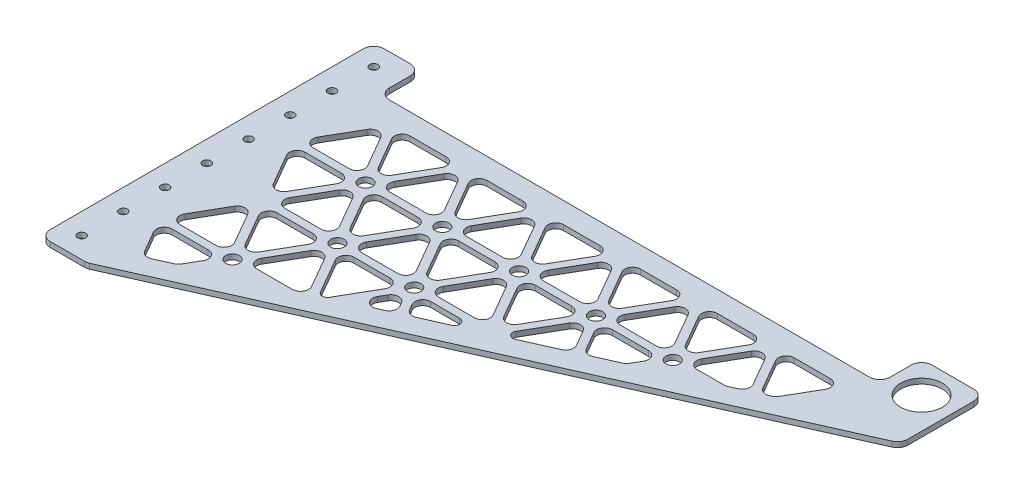
from build123d import *

# Parameters (mm, degrees)
BOSS_EXTRUDE1_DEPTH = 1.5875
SKETCH2_R           = 2.4892
SKETCH2_R_2         = 12.7
CUT_EXTRUDE1_DEPTH  = 424.43121785
FILLET1_R           = 6.35
SKETCH3_R           = 4.124445986
CUT_EXTRUDE2_DEPTH  = 424.43121785
FILLET2_R           = 4.7625


with BuildPart() as part:
    # Sketch1 → Boss-Extrude1 (new, symmetric)
    with BuildSketch(Plane(origin=(0, 0, 0), x_dir=(1, 0, 0), z_dir=(0, 1, 0))):
        Polygon((0, 0), (0, 203.2), (28.575, 203.2), (28.575, 177.8), (333.375, 177.8), (333.375, 203.2), (371.475, 203.2), (371.475, 152.668916192), (28.575, 0), align=None)
    extrude(amount=BOSS_EXTRUDE1_DEPTH, both=True)

    # Sketch2 → Cut-Extrude1 (cut, through all)
    with BuildSketch(Plane(origin=(0, 1.5875, 0), x_dir=(1, 0, 0), z_dir=(0, 1, 0))):
        with Locations(Location((12.7, 190.5, 0), (0, 0, 270))):
            Circle(SKETCH2_R)
        with Locations(Location((12.7, 165.1, 0), (0, 0, 270))):
            Circle(SKETCH2_R)
        with Locations(Location((12.7, 139.7, 0), (0, 0, 270))):
            Circle(SKETCH2_R)
        with Locations(Location((12.7, 114.3, 0), (0, 0, 270))):
            Circle(SKETCH2_R)
        with Locations(Location((12.7, 88.9, 0), (0, 0, 270))):
            Circle(SKETCH2_R)
        with Locations(Location((12.7, 63.5, 0), (0, 0, 270))):
            Circle(SKETCH2_R)
        with Locations(Location((12.7, 38.1, 0), (0, 0, 270))):
            Circle(SKETCH2_R)
        with Locations(Location((12.7, 12.7, 0), (0, 0, 270))):
            Circle(SKETCH2_R)
        with Locations(Location((352.425, 184.15, 0), (0, 0, 270))):
            Circle(SKETCH2_R_2)
    extrude(amount=-CUT_EXTRUDE1_DEPTH, mode=Mode.SUBTRACT)

    # Fillet1
    fillet1_edges = [part.edges().sort_by_distance(p)[0] for p in [
        (0, 0, 0),
        (0, 0, -203.2),
        (28.575, 0, -203.2),
        (28.575, 0, -177.8),
        (333.375, 0, -177.8),
        (333.375, 0, -203.2),
        (371.475, 0, -203.2),
        (371.475, 0, -152.668916192),
        (28.575, 0, 0),
    ]]
    fillet(fillet1_edges, radius=FILLET1_R)

    # Sketch3 → Cut-Extrude2 (cut, through all)
    with BuildSketch(Plane(origin=(0, 1.5875, 0), x_dir=(1, 0, 0), z_dir=(0, 1, 0))):
        with BuildLine():
            Line((120.68762701, 55.5625), (137.185410952, 84.1375))
            Line((137.185410952, 84.1375), (98.690581754, 84.1375))
            Line((98.690581754, 84.1375), (115.188365696, 55.5625))
            ThreePointArc((115.188365696, 55.5625), (117.937996353, 53.975), (120.68762701, 55.5625))
        make_face()
        Polygon((141.309856938, 81.75625), (127.58490085, 57.983928725), (149.421620805, 67.706262842), align=None)
        Polygon((106.101157685, 48.41875), (112.236454516, 51.150360142), (94.566135768, 81.75625), (75.318721169, 48.41875), align=None)
        with BuildLine():
            Line((145.434302923, 84.1375), (153.796346251, 69.654016101))
            Line((153.796346251, 69.654016101), (172.680971947, 78.061993172))
            ThreePointArc((172.680971947, 78.061993172), (174.495201737, 81.622619618), (171.389583105, 84.1375))
            Line((171.389583105, 84.1375), (145.434302923, 84.1375))
        make_face()
        with BuildLine():
            ThreePointArc((195.387344652, 94.458706266), (195.777490488, 90.746716591), (199.42836415, 89.970699438))
            Line((199.42836415, 89.970699438), (223.791953383, 100.818068242))
            Line((223.791953383, 100.818068242), (211.425438692, 122.2375))
            Line((211.425438692, 122.2375), (195.387344652, 94.458706266))
        make_face()
        Polygon((215.549884677, 124.61875), (228.166678829, 102.765821501), (246.016187789, 110.712934908), (254.044713875, 124.61875), align=None)
        Polygon((42.240847384, 19.986308002), (57.266324231, 26.676081304), (67.069829198, 43.65625), (28.575, 43.65625), align=None)
        Polygon((262.293605846, 129.38125), (287.945909992, 129.38125), (298.162285961, 133.929873641), (281.541020445, 162.71875), align=None)
        Polygon((285.665466431, 165.1), (302.537011407, 135.8776269), (308.932808975, 138.725219443), (324.160295629, 165.1), align=None)
        Polygon((90.441689783, 165.1), (51.946860585, 165.1), (71.194275184, 131.7625), align=None)
        Polygon((137.185410952, 165.1), (98.690581754, 165.1), (117.937996353, 131.7625), align=None)
        Polygon((258.169159861, 131.7625), (277.41657446, 165.1), (238.921745262, 165.1), align=None)
        Polygon((183.929132121, 165.1), (145.434302923, 165.1), (164.681717522, 131.7625), align=None)
        Polygon((211.425438692, 131.7625), (230.672853291, 165.1), (192.178024092, 165.1), align=None)
        Polygon((28.575, 129.38125), (67.069829198, 129.38125), (47.822414599, 162.71875), align=None)
        Polygon((94.566135768, 162.71875), (75.318721169, 129.38125), (113.813550367, 129.38125), align=None)
        Polygon((47.822414599, 91.28125), (67.069829198, 124.61875), (28.575, 124.61875), align=None)
        Polygon((90.441689783, 88.9), (71.194275184, 122.2375), (51.946860585, 88.9), align=None)
        Polygon((113.813550367, 124.61875), (75.318721169, 124.61875), (94.566135768, 91.28125), align=None)
        Polygon((160.557271537, 129.38125), (141.309856938, 162.71875), (122.062442339, 129.38125), align=None)
        Polygon((168.806163508, 129.38125), (207.300992706, 129.38125), (188.053578107, 162.71875), align=None)
        Polygon((234.797299276, 162.71875), (215.549884677, 129.38125), (254.044713875, 129.38125), align=None)
        Polygon((188.053578107, 91.28125), (207.300992706, 124.61875), (168.806163508, 124.61875), align=None)
        Polygon((122.062442339, 124.61875), (141.309856938, 91.28125), (160.557271537, 124.61875), align=None)
        Polygon((28.575, 48.41875), (67.069829198, 48.41875), (47.822414599, 81.75625), align=None)
        Polygon((51.946860585, 84.1375), (71.194275184, 50.8), (90.441689783, 84.1375), align=None)
        Polygon((164.681717522, 122.2375), (145.434302923, 88.9), (183.929132121, 88.9), align=None)
        Polygon((98.690581754, 88.9), (137.185410952, 88.9), (117.937996353, 122.2375), align=None)
        with Locations(Location((211.425438692, 127, 0), (0, 0, 270))):
            Circle(SKETCH3_R)
        with Locations(Location((71.194275184, 127, 0), (0, 0, 270))):
            Circle(SKETCH3_R)
        with Locations(Location((117.937996353, 127, 0), (0, 0, 270))):
            Circle(SKETCH3_R)
        with Locations(Location((258.169159861, 127, 0), (0, 0, 270))):
            Circle(SKETCH3_R)
        with Locations(Location((94.566135768, 86.51875, 0), (0, 0, 270))):
            Circle(SKETCH3_R)
        with Locations(Location((164.681717522, 127, 0), (0, 0, 270))):
            Circle(SKETCH3_R)
        with Locations(Location((141.309856938, 86.51875, 0), (0, 0, 270))):
            Circle(SKETCH3_R)
        with Locations(Location((71.194275184, 46.0375, 0), (0, 0, 270))):
            Circle(SKETCH3_R)
    extrude(amount=-CUT_EXTRUDE2_DEPTH, mode=Mode.SUBTRACT)

    # Fillet2
    fillet2_edges = [part.edges().sort_by_distance(p)[0] for p in [
        (168.806163508, 0, -129.38125),
        (188.053578107, 0, -162.71875),
        (207.300992706, 0, -129.38125),
        (183.929132121, 0, -165.1),
        (164.681717522, 0, -131.7625),
        (145.434302923, 0, -165.1),
        (164.681717522, 0, -122.2375),
        (183.929132121, 0, -88.9),
        (145.434302923, 0, -88.9),
        (188.053578107, 0, -91.28125),
        (168.806163508, 0, -124.61875),
        (207.300992706, 0, -124.61875),
        (122.062442339, 0, -124.61875),
        (160.557271537, 0, -124.61875),
        (141.309856938, 0, -91.28125),
        (160.557271537, 0, -129.38125),
        (122.062442339, 0, -129.38125),
        (141.309856938, 0, -162.71875),
        (117.937996353, 0, -131.7625),
        (98.690581754, 0, -165.1),
        (137.185410952, 0, -165.1),
        (302.537011407, 0, -135.8776269),
        (285.665466431, 0, -165.1),
        (324.160295629, 0, -165.1),
        (308.932808975, 0, -138.725219443),
        (258.169159861, 0, -131.7625),
        (238.921745262, 0, -165.1),
        (277.41657446, 0, -165.1),
        (287.945909992, 0, -129.38125),
        (262.293605846, 0, -129.38125),
        (281.541020445, 0, -162.71875),
        (298.162285961, 0, -133.929873641),
        (228.166678829, 0, -102.765821501),
        (215.549884677, 0, -124.61875),
        (254.044713875, 0, -124.61875),
        (246.016187789, 0, -110.712934908),
        (234.797299276, 0, -162.71875),
        (254.044713875, 0, -129.38125),
        (215.549884677, 0, -129.38125),
        (192.178024092, 0, -165.1),
        (230.672853291, 0, -165.1),
        (211.425438692, 0, -131.7625),
        (51.946860585, 0, -84.1375),
        (90.441689783, 0, -84.1375),
        (71.194275184, 0, -50.8),
        (90.441689783, 0, -88.9),
        (51.946860585, 0, -88.9),
        (71.194275184, 0, -122.2375),
        (94.566135768, 0, -162.71875),
        (113.813550367, 0, -129.38125),
        (75.318721169, 0, -129.38125),
        (28.575, 0, -129.38125),
        (47.822414599, 0, -162.71875),
        (67.069829198, 0, -129.38125),
        (51.946860585, 0, -165.1),
        (90.441689783, 0, -165.1),
        (71.194275184, 0, -131.7625),
        (47.822414599, 0, -91.28125),
        (28.575, 0, -124.61875),
        (67.069829198, 0, -124.61875),
        (28.575, 0, -48.41875),
        (47.822414599, 0, -81.75625),
        (67.069829198, 0, -48.41875),
        (113.813550367, 0, -124.61875),
        (94.566135768, 0, -91.28125),
        (75.318721169, 0, -124.61875),
        (98.690581754, 0, -88.9),
        (117.937996353, 0, -122.2375),
        (137.185410952, 0, -88.9),
        (106.101157685, 0, -48.41875),
        (75.318721169, 0, -48.41875),
        (94.566135768, 0, -81.75625),
        (112.236454516, 0, -51.150360142),
        (127.58490085, 0, -57.983928725),
        (141.309856938, 0, -81.75625),
        (149.421620805, 0, -67.706262842),
        (98.690581754, 0, -84.1375),
        (137.185410952, 0, -84.1375),
        (153.796346251, 0, -69.654016101),
        (145.434302923, 0, -84.1375),
        (211.425438692, 0, -122.2375),
        (223.791953383, 0, -100.818068242),
        (42.240847384, 0, -19.986308002),
        (28.575, 0, -43.65625),
        (67.069829198, 0, -43.65625),
        (57.266324231, 0, -26.676081304),
    ]]
    fillet(fillet2_edges, radius=FILLET2_R)


solid = part.part
